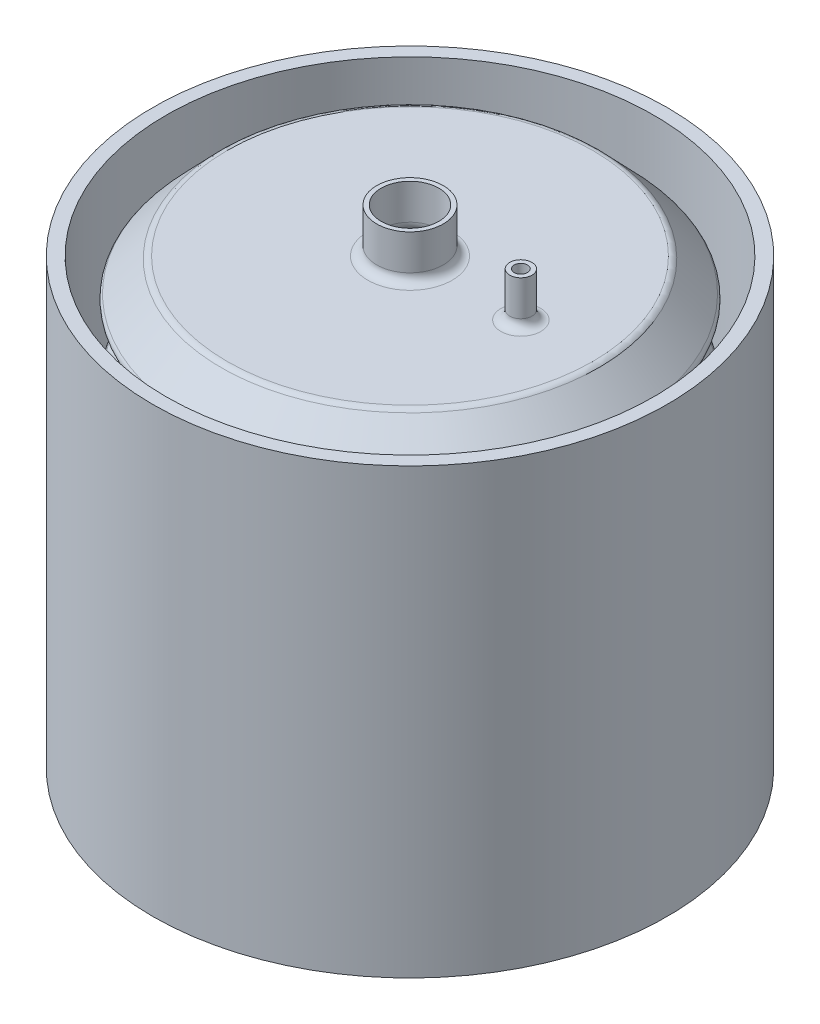
from build123d import *

# Parameters (mm, degrees)
ESBO_O2_R                = 2.5
RESSALTO_EXTRUS_O1_DEPTH = 10
FILETE1_R                = 2
CASCA2_T                 = -1
ESBO_O6_R                = 58
ESBO_O6_R_2              = 55
RESSALTO_EXTRUS_O2_DEPTH = 100


with BuildPart() as part:
    # Esboço1 → Revolução1 (revolve)
    with BuildSketch(Plane(origin=(0, 0, 0), x_dir=(0, 0, -1), z_dir=(1, 0, 0))):
        with BuildLine():
            Line((0, 0), (41.147564248, 0))
            ThreePointArc((41.147564248, 0), (41.931743018, 0.160145751), (42.59033889, 0.614936344))
            Line((42.59033889, 0.614936344), (49.040799334, 7.334165973))
            ThreePointArc((49.040799334, 7.334165973), (49.442774642, 8.333333333), (49.040799334, 9.332500694))
            Line((49.040799334, 9.332500694), (42, 16.666666667))
            Line((42, 16.666666667), (49.040799334, 24.000832639))
            ThreePointArc((49.040799334, 24.000832639), (49.442774642, 25), (49.040799334, 25.999167361))
            Line((49.040799334, 25.999167361), (42, 33.333333333))
            Line((42, 33.333333333), (49.040799334, 40.667499306))
            ThreePointArc((49.040799334, 40.667499306), (49.442774642, 41.666666667), (49.040799334, 42.665834027))
            Line((49.040799334, 42.665834027), (42, 50))
            Line((42, 50), (49.040799334, 57.334165973))
            ThreePointArc((49.040799334, 57.334165973), (49.442774642, 58.333333333), (49.040799334, 59.332500694))
            Line((49.040799334, 59.332500694), (42, 66.666666667))
            Line((42, 66.666666667), (49.040799334, 74.000832639))
            ThreePointArc((49.040799334, 74.000832639), (49.442774642, 75), (49.040799334, 75.999167361))
            Line((49.040799334, 75.999167361), (42, 83.333333333))
            Line((42, 83.333333333), (49.040799334, 90.667499306))
            ThreePointArc((49.040799334, 90.667499306), (49.442774642, 91.666666667), (49.040799334, 92.665834027))
            Line((49.040799334, 92.665834027), (42.543068757, 99.434303378))
            ThreePointArc((42.543068757, 99.434303378), (41.937208551, 99.85267758), (41.21582123, 100))
            Line((41.21582123, 100), (9.5, 100))
            ThreePointArc((9.5, 100), (8.085786438, 100.585786438), (7.5, 102))
            Line((7.5, 102), (7.5, 110))
            Line((7.5, 110), (0, 110))
            Line((0, 110), (0, 100))
            Line((0, 100), (0, 0))
        make_face()
    revolve(axis=Axis((0, 0, 0), (0, 1, 0)))

    # Esboço2 → Ressalto-extrusão1 (add)
    with BuildSketch(Plane(origin=(0, 100, 0), x_dir=(1, 0, 0), z_dir=(0, 1, 0))):
        with Locations((25, 0)):
            Circle(ESBO_O2_R)
    extrude(amount=RESSALTO_EXTRUS_O1_DEPTH)

    # Filete1
    filete1_edges = [part.edges().sort_by_distance(p)[0] for p in [
        (22.5, 100, 0),
    ]]
    fillet(filete1_edges, radius=FILETE1_R)

    # Casca2
    casca2_openings = [part.faces().sort_by_distance(p)[0] for p in [
        (25, 110, 0),
        (0, 110, 0),
    ]]
    offset(amount=CASCA2_T, openings=casca2_openings, kind=Kind.INTERSECTION)


with BuildPart() as body_2:
    # Esboço6 → Ressalto-extrusão2 (new body)
    with BuildSketch(Plane(origin=(0, 0, 0), x_dir=(1, 0, 0), z_dir=(0, 1, 0))):
        Circle(ESBO_O6_R)
        Circle(ESBO_O6_R_2, mode=Mode.SUBTRACT)
    extrude(amount=RESSALTO_EXTRUS_O2_DEPTH)


solid = Compound([part.part, body_2.part])
